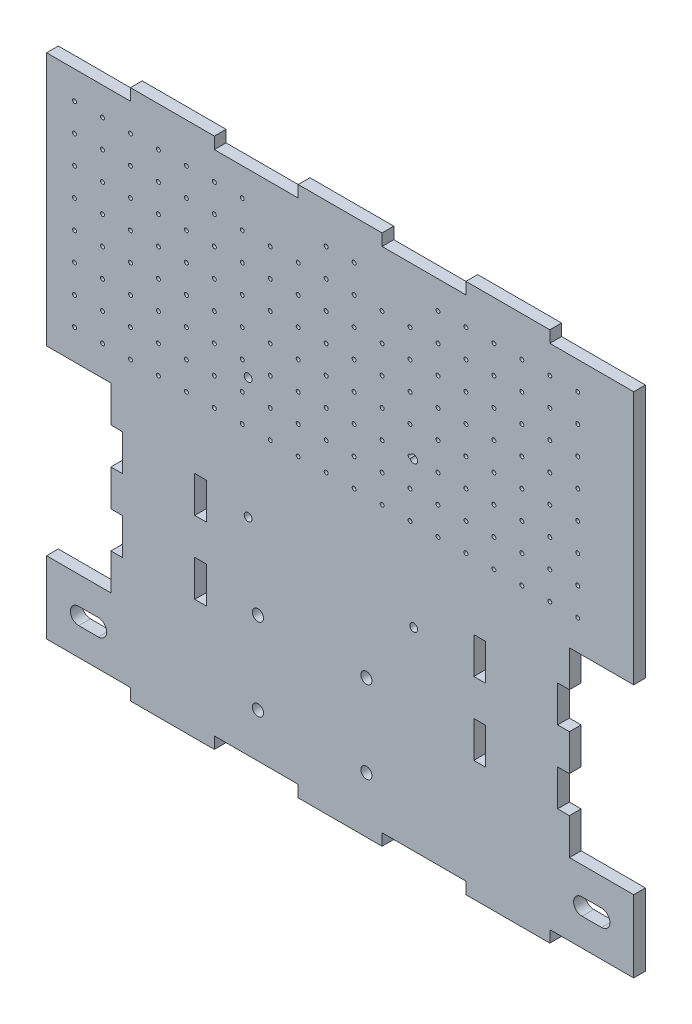
from build123d import *

# Parameters (mm, degrees)
SKETCH1_W           = 266.7
SKETCH1_H           = 241.3
BOSS_EXTRUDE1_DEPTH = 5.334
SKETCH2_W           = 29.21
SKETCH2_H           = 82.55
CUT_EXTRUDE1_DEPTH  = 180.908578328
SKETCH9_W           = 5.334
SKETCH9_H           = 16.51
CUT_EXTRUDE2_DEPTH  = 180.908578328
SKETCH10_R          = 2.54
CUT_EXTRUDE3_DEPTH  = 180.908578328
SKETCH23_W          = 5.334
SKETCH23_H          = 16.51
CUT_EXTRUDE8_DEPTH  = 180.908578328
SKETCH28_W          = 38.1
SKETCH28_H          = 5.334
CUT_EXTRUDE13_DEPTH = 180.908578328
SKETCH29_W          = 38.1
SKETCH29_H          = 5.334
CUT_EXTRUDE14_DEPTH = 180.908578328
SKETCH30_R          = 0.889
CUT_EXTRUDE15_DEPTH = 180.908578328
SKETCH32_R          = 1.778
CUT_EXTRUDE16_DEPTH = 180.908578328
CUT_EXTRUDE19_DEPTH = 180.908578328


with BuildPart() as part:
    # Sketch1 → Boss-Extrude1 (new body)
    with BuildSketch(Plane.XY):
        Rectangle(SKETCH1_W, SKETCH1_H)
    extrude(amount=BOSS_EXTRUDE1_DEPTH)

    # Sketch2 → Cut-Extrude1 (cut, through all)
    with BuildSketch(Plane(origin=(0, 0, 0), x_dir=(-1, 0, 0), z_dir=(0, 0, -1))):
        with Locations((118.745, -41.275)):
            Rectangle(SKETCH2_W, SKETCH2_H)
        with Locations((-118.745, -41.275)):
            Rectangle(SKETCH2_W, SKETCH2_H)
    extrude(amount=-CUT_EXTRUDE1_DEPTH, mode=Mode.SUBTRACT)

    # Sketch9 → Cut-Extrude2 (cut, through all)
    with BuildSketch(Plane.XY.offset(5.334)):
        with Locations((-101.473, -24.765)):
            Rectangle(SKETCH9_W, SKETCH9_H)
        with Locations((-101.473, -57.785)):
            Rectangle(SKETCH9_W, SKETCH9_H)
        with Locations((101.473, -57.785)):
            Rectangle(SKETCH9_W, SKETCH9_H)
        with Locations((101.473, -24.765)):
            Rectangle(SKETCH9_W, SKETCH9_H)
    extrude(amount=-CUT_EXTRUDE2_DEPTH, mode=Mode.SUBTRACT)

    # Sketch10 → Cut-Extrude3 (cut, through all)
    with BuildSketch(Plane.XY.offset(5.334)):
        with Locations((-37.338, -95.25)):
            Circle(SKETCH10_R)
        with Locations((11.938, -95.25)):
            Circle(SKETCH10_R)
        with Locations((11.938, -57.912)):
            Circle(SKETCH10_R)
        with Locations((-37.338, -57.912)):
            Circle(SKETCH10_R)
    extrude(amount=-CUT_EXTRUDE3_DEPTH, mode=Mode.SUBTRACT)

    # Sketch23 → Cut-Extrude8 (cut, through all)
    with BuildSketch(Plane.XY.offset(5.334)):
        with Locations((-63.373, -57.785)):
            Rectangle(SKETCH23_W, SKETCH23_H)
        with Locations((63.373, -24.765)):
            Rectangle(SKETCH23_W, SKETCH23_H)
        with Locations((63.373, -57.785)):
            Rectangle(SKETCH23_W, SKETCH23_H)
        with Locations((-63.373, -24.765)):
            Rectangle(SKETCH23_W, SKETCH23_H)
    extrude(amount=-CUT_EXTRUDE8_DEPTH, mode=Mode.SUBTRACT)

    # Sketch28 → Cut-Extrude13 (cut, through all)
    with BuildSketch(Plane(origin=(0, 0, 0), x_dir=(-1, 0, 0), z_dir=(0, 0, -1))):
        with Locations((-114.3, -117.983)):
            Rectangle(SKETCH28_W, SKETCH28_H)
        with Locations((-38.1, -117.983)):
            Rectangle(SKETCH28_W, SKETCH28_H)
        with Locations((38.1, -117.983)):
            Rectangle(SKETCH28_W, SKETCH28_H)
        with Locations((114.3, -117.983)):
            Rectangle(SKETCH28_W, SKETCH28_H)
    extrude(amount=-CUT_EXTRUDE13_DEPTH, mode=Mode.SUBTRACT)

    # Sketch29 → Cut-Extrude14 (cut, through all)
    with BuildSketch(Plane(origin=(0, 0, 0), x_dir=(-1, 0, 0), z_dir=(0, 0, -1))):
        with Locations((-114.3, 117.983)):
            Rectangle(SKETCH29_W, SKETCH29_H)
        with Locations((-38.1, 117.983)):
            Rectangle(SKETCH29_W, SKETCH29_H)
        with Locations((38.1, 117.983)):
            Rectangle(SKETCH29_W, SKETCH29_H)
        with Locations((114.3, 117.983)):
            Rectangle(SKETCH29_W, SKETCH29_H)
    extrude(amount=-CUT_EXTRUDE14_DEPTH, mode=Mode.SUBTRACT)

    # Sketch30 → Cut-Extrude15 (cut, through all)
    with BuildSketch(Plane.XY.offset(5.334)):
        with Locations((-120.65, 102.616)):
            Circle(SKETCH30_R)
        with Locations((-107.95, 102.616)):
            Circle(SKETCH30_R)
        with Locations((-95.25, 102.616)):
            Circle(SKETCH30_R)
        with Locations((-82.55, 102.616)):
            Circle(SKETCH30_R)
        with Locations((-69.85, 102.616)):
            Circle(SKETCH30_R)
        with Locations((-57.15, 102.616)):
            Circle(SKETCH30_R)
        with Locations((-44.45, 102.616)):
            Circle(SKETCH30_R)
        with Locations((-6.35, 102.616)):
            Circle(SKETCH30_R)
        with Locations((6.35, 102.616)):
            Circle(SKETCH30_R)
        with Locations((44.45, 102.616)):
            Circle(SKETCH30_R)
        with Locations((57.15, 102.616)):
            Circle(SKETCH30_R)
        with Locations((69.85, 102.616)):
            Circle(SKETCH30_R)
        with Locations((82.55, 102.616)):
            Circle(SKETCH30_R)
        with Locations((95.25, 102.616)):
            Circle(SKETCH30_R)
        with Locations((107.95, 102.616)):
            Circle(SKETCH30_R)
        with Locations((-107.95, 89.916)):
            Circle(SKETCH30_R)
        with Locations((-95.25, 89.916)):
            Circle(SKETCH30_R)
        with Locations((-82.55, 89.916)):
            Circle(SKETCH30_R)
        with Locations((-69.85, 89.916)):
            Circle(SKETCH30_R)
        with Locations((-57.15, 89.916)):
            Circle(SKETCH30_R)
        with Locations((-44.45, 89.916)):
            Circle(SKETCH30_R)
        with Locations((-31.75, 89.916)):
            Circle(SKETCH30_R)
        with Locations((-19.05, 89.916)):
            Circle(SKETCH30_R)
        with Locations((-6.35, 89.916)):
            Circle(SKETCH30_R)
        with Locations((6.35, 89.916)):
            Circle(SKETCH30_R)
        with Locations((19.05, 89.916)):
            Circle(SKETCH30_R)
        with Locations((31.75, 89.916)):
            Circle(SKETCH30_R)
        with Locations((44.45, 89.916)):
            Circle(SKETCH30_R)
        with Locations((57.15, 89.916)):
            Circle(SKETCH30_R)
        with Locations((69.85, 89.916)):
            Circle(SKETCH30_R)
        with Locations((82.55, 89.916)):
            Circle(SKETCH30_R)
        with Locations((95.25, 89.916)):
            Circle(SKETCH30_R)
        with Locations((107.95, 89.916)):
            Circle(SKETCH30_R)
        with Locations((-107.95, 77.216)):
            Circle(SKETCH30_R)
        with Locations((-95.25, 77.216)):
            Circle(SKETCH30_R)
        with Locations((-82.55, 77.216)):
            Circle(SKETCH30_R)
        with Locations((-69.85, 77.216)):
            Circle(SKETCH30_R)
        with Locations((-57.15, 77.216)):
            Circle(SKETCH30_R)
        with Locations((-44.45, 77.216)):
            Circle(SKETCH30_R)
        with Locations((-31.75, 77.216)):
            Circle(SKETCH30_R)
        with Locations((-19.05, 77.216)):
            Circle(SKETCH30_R)
        with Locations((-6.35, 77.216)):
            Circle(SKETCH30_R)
        with Locations((6.35, 77.216)):
            Circle(SKETCH30_R)
        with Locations((19.05, 77.216)):
            Circle(SKETCH30_R)
        with Locations((31.75, 77.216)):
            Circle(SKETCH30_R)
        with Locations((44.45, 77.216)):
            Circle(SKETCH30_R)
        with Locations((57.15, 77.216)):
            Circle(SKETCH30_R)
        with Locations((69.85, 77.216)):
            Circle(SKETCH30_R)
        with Locations((82.55, 77.216)):
            Circle(SKETCH30_R)
        with Locations((95.25, 77.216)):
            Circle(SKETCH30_R)
        with Locations((107.95, 77.216)):
            Circle(SKETCH30_R)
        with Locations((-107.95, 64.516)):
            Circle(SKETCH30_R)
        with Locations((-95.25, 64.516)):
            Circle(SKETCH30_R)
        with Locations((-82.55, 64.516)):
            Circle(SKETCH30_R)
        with Locations((-69.85, 64.516)):
            Circle(SKETCH30_R)
        with Locations((-57.15, 64.516)):
            Circle(SKETCH30_R)
        with Locations((-44.45, 64.516)):
            Circle(SKETCH30_R)
        with Locations((-31.75, 64.516)):
            Circle(SKETCH30_R)
        with Locations((-19.05, 64.516)):
            Circle(SKETCH30_R)
        with Locations((-6.35, 64.516)):
            Circle(SKETCH30_R)
        with Locations((6.35, 64.516)):
            Circle(SKETCH30_R)
        with Locations((19.05, 64.516)):
            Circle(SKETCH30_R)
        with Locations((31.75, 64.516)):
            Circle(SKETCH30_R)
        with Locations((44.45, 64.516)):
            Circle(SKETCH30_R)
        with Locations((57.15, 64.516)):
            Circle(SKETCH30_R)
        with Locations((69.85, 64.516)):
            Circle(SKETCH30_R)
        with Locations((82.55, 64.516)):
            Circle(SKETCH30_R)
        with Locations((95.25, 64.516)):
            Circle(SKETCH30_R)
        with Locations((107.95, 64.516)):
            Circle(SKETCH30_R)
        with Locations((-107.95, 51.816)):
            Circle(SKETCH30_R)
        with Locations((-95.25, 51.816)):
            Circle(SKETCH30_R)
        with Locations((-82.55, 51.816)):
            Circle(SKETCH30_R)
        with Locations((-69.85, 51.816)):
            Circle(SKETCH30_R)
        with Locations((-57.15, 51.816)):
            Circle(SKETCH30_R)
        with Locations((-44.45, 51.816)):
            Circle(SKETCH30_R)
        with Locations((-31.75, 51.816)):
            Circle(SKETCH30_R)
        with Locations((-19.05, 51.816)):
            Circle(SKETCH30_R)
        with Locations((-6.35, 51.816)):
            Circle(SKETCH30_R)
        with Locations((6.35, 51.816)):
            Circle(SKETCH30_R)
        with Locations((19.05, 51.816)):
            Circle(SKETCH30_R)
        with Locations((31.75, 51.816)):
            Circle(SKETCH30_R)
        with Locations((44.45, 51.816)):
            Circle(SKETCH30_R)
        with Locations((57.15, 51.816)):
            Circle(SKETCH30_R)
        with Locations((69.85, 51.816)):
            Circle(SKETCH30_R)
        with Locations((82.55, 51.816)):
            Circle(SKETCH30_R)
        with Locations((95.25, 51.816)):
            Circle(SKETCH30_R)
        with Locations((107.95, 51.816)):
            Circle(SKETCH30_R)
        with Locations((-107.95, 39.116)):
            Circle(SKETCH30_R)
        with Locations((-95.25, 39.116)):
            Circle(SKETCH30_R)
        with Locations((-82.55, 39.116)):
            Circle(SKETCH30_R)
        with Locations((-69.85, 39.116)):
            Circle(SKETCH30_R)
        with Locations((-57.15, 39.116)):
            Circle(SKETCH30_R)
        with Locations((-44.45, 39.116)):
            Circle(SKETCH30_R)
        with Locations((-31.75, 39.116)):
            Circle(SKETCH30_R)
        with Locations((-19.05, 39.116)):
            Circle(SKETCH30_R)
        with Locations((-6.35, 39.116)):
            Circle(SKETCH30_R)
        with Locations((6.35, 39.116)):
            Circle(SKETCH30_R)
        with Locations((19.05, 39.116)):
            Circle(SKETCH30_R)
        with Locations((31.75, 39.116)):
            Circle(SKETCH30_R)
        with Locations((44.45, 39.116)):
            Circle(SKETCH30_R)
        with Locations((57.15, 39.116)):
            Circle(SKETCH30_R)
        with Locations((69.85, 39.116)):
            Circle(SKETCH30_R)
        with Locations((82.55, 39.116)):
            Circle(SKETCH30_R)
        with Locations((95.25, 39.116)):
            Circle(SKETCH30_R)
        with Locations((107.95, 39.116)):
            Circle(SKETCH30_R)
        with Locations((-107.95, 26.416)):
            Circle(SKETCH30_R)
        with Locations((-95.25, 26.416)):
            Circle(SKETCH30_R)
        with Locations((-82.55, 26.416)):
            Circle(SKETCH30_R)
        with Locations((-69.85, 26.416)):
            Circle(SKETCH30_R)
        with Locations((-57.15, 26.416)):
            Circle(SKETCH30_R)
        with Locations((-44.45, 26.416)):
            Circle(SKETCH30_R)
        with Locations((-31.75, 26.416)):
            Circle(SKETCH30_R)
        with Locations((-19.05, 26.416)):
            Circle(SKETCH30_R)
        with Locations((-6.35, 26.416)):
            Circle(SKETCH30_R)
        with Locations((6.35, 26.416)):
            Circle(SKETCH30_R)
        with Locations((19.05, 26.416)):
            Circle(SKETCH30_R)
        with Locations((31.75, 26.416)):
            Circle(SKETCH30_R)
        with Locations((44.45, 26.416)):
            Circle(SKETCH30_R)
        with Locations((57.15, 26.416)):
            Circle(SKETCH30_R)
        with Locations((69.85, 26.416)):
            Circle(SKETCH30_R)
        with Locations((82.55, 26.416)):
            Circle(SKETCH30_R)
        with Locations((95.25, 26.416)):
            Circle(SKETCH30_R)
        with Locations((107.95, 26.416)):
            Circle(SKETCH30_R)
        with Locations((-107.95, 13.716)):
            Circle(SKETCH30_R)
        with Locations((-95.25, 13.716)):
            Circle(SKETCH30_R)
        with Locations((-82.55, 13.716)):
            Circle(SKETCH30_R)
        with Locations((-69.85, 13.716)):
            Circle(SKETCH30_R)
        with Locations((-57.15, 13.716)):
            Circle(SKETCH30_R)
        with Locations((-44.45, 13.716)):
            Circle(SKETCH30_R)
        with Locations((-31.75, 13.716)):
            Circle(SKETCH30_R)
        with Locations((-19.05, 13.716)):
            Circle(SKETCH30_R)
        with Locations((-6.35, 13.716)):
            Circle(SKETCH30_R)
        with Locations((6.35, 13.716)):
            Circle(SKETCH30_R)
        with Locations((19.05, 13.716)):
            Circle(SKETCH30_R)
        with Locations((31.75, 13.716)):
            Circle(SKETCH30_R)
        with Locations((44.45, 13.716)):
            Circle(SKETCH30_R)
        with Locations((57.15, 13.716)):
            Circle(SKETCH30_R)
        with Locations((69.85, 13.716)):
            Circle(SKETCH30_R)
        with Locations((82.55, 13.716)):
            Circle(SKETCH30_R)
        with Locations((95.25, 13.716)):
            Circle(SKETCH30_R)
        with Locations((107.95, 13.716)):
            Circle(SKETCH30_R)
        with Locations((-120.65, 89.916)):
            Circle(SKETCH30_R)
        with Locations((-120.65, 77.216)):
            Circle(SKETCH30_R)
        with Locations((-120.65, 64.516)):
            Circle(SKETCH30_R)
        with Locations((-120.65, 51.816)):
            Circle(SKETCH30_R)
        with Locations((-120.65, 39.116)):
            Circle(SKETCH30_R)
        with Locations((-120.65, 26.416)):
            Circle(SKETCH30_R)
        with Locations((-120.65, 13.716)):
            Circle(SKETCH30_R)
    extrude(amount=-CUT_EXTRUDE15_DEPTH, mode=Mode.SUBTRACT)

    # Sketch32 → Cut-Extrude16 (cut, through all)
    with BuildSketch(Plane(origin=(0, 0, 0), x_dir=(-1, 0, 0), z_dir=(0, 0, -1))):
        with Locations((-33.403746036, -27.388735102)):
            Circle(SKETCH32_R)
        with Locations((41.780253964, -21.546735102)):
            Circle(SKETCH32_R)
        with Locations((-33.403746036, 38.905264898)):
            Circle(SKETCH32_R)
        with Locations((41.780253964, 33.317264898)):
            Circle(SKETCH32_R)
    extrude(amount=-CUT_EXTRUDE16_DEPTH, mode=Mode.SUBTRACT)

    # Sketch35 → Cut-Extrude19 (cut, through all)
    with BuildSketch(Plane.XY.offset(5.334)):
        with BuildLine():
            Line((-109.855, -102.743), (-118.745, -102.743))
            ThreePointArc((-118.745, -102.743), (-122.555, -98.933), (-118.745, -95.123))
            Line((-118.745, -95.123), (-109.855, -95.123))
            ThreePointArc((-109.855, -95.123), (-106.045, -98.933), (-109.855, -102.743))
        make_face()
        with BuildLine():
            Line((109.855, -95.123), (118.745, -95.123))
            ThreePointArc((118.745, -95.123), (122.555, -98.933), (118.745, -102.743))
            Line((118.745, -102.743), (109.855, -102.743))
            ThreePointArc((109.855, -102.743), (106.045, -98.933), (109.855, -95.123))
        make_face()
    extrude(amount=-CUT_EXTRUDE19_DEPTH, mode=Mode.SUBTRACT)


solid = part.part
